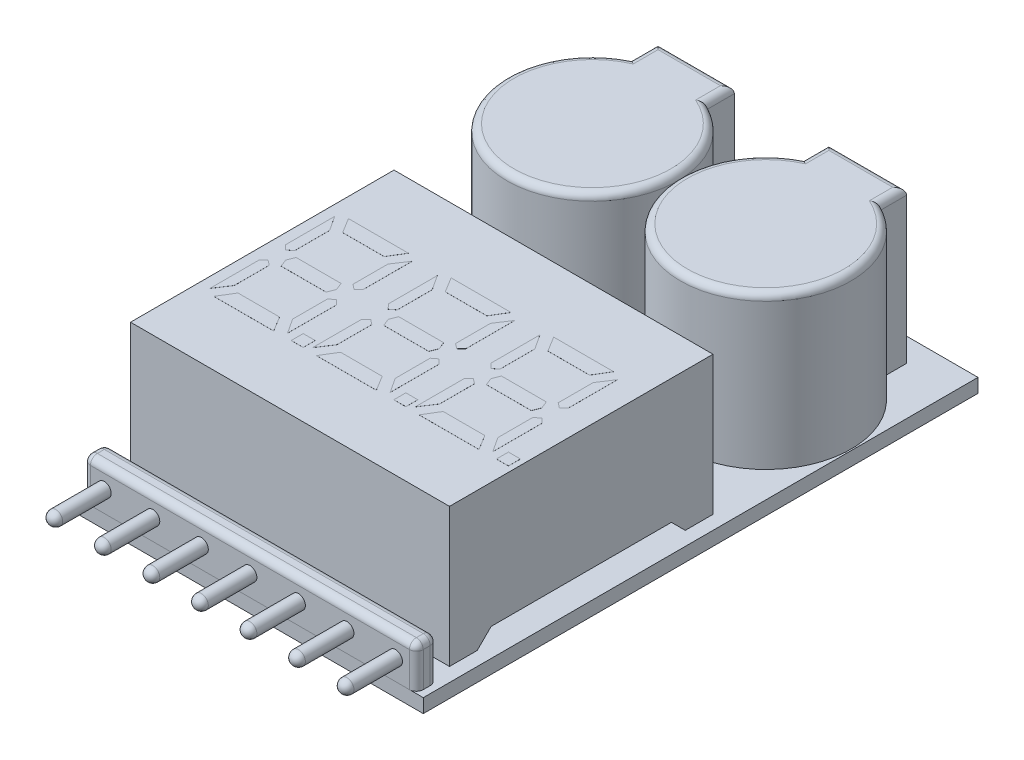
from build123d import *

# Parameters (mm, degrees)
IZIM1_W                         = 25
IZIM1_H                         = 40
Y_KSEKLIK_EKSTR_ZYON1_DEPTH     = 1
IZIM2_W                         = 24
IZIM2_H                         = 1.5
Y_KSEKLIK_EKSTR_ZYON2_DEPTH     = 3
IZIM3_R                         = 0.5
Y_KSEKLIK_EKSTR_ZYON3_DEPTH     = 4
IZIM4_W                         = 23
IZIM4_H                         = 19
Y_KSEKLIK_EKSTR_ZYON4_DEPTH     = 10
Y_KSEKLIK_EKSTR_ZYON10_DEPTH    = 11
KES_EKSTR_ZYON2_DEPTH           = 40
KES_EKSTR_ZYON3_DEPTH           = 20
RADYUS1_R                       = 0.5
RADYUS2_R                       = 0.5
Y_KSEKLIK_EKSTR_ZYON11_DEPTH    = 0.005
Y_KSEKLIK_EKSTR_ZYON11_2_DEPTH  = 0.005
Y_KSEKLIK_EKSTR_ZYON11_3_DEPTH  = 0.005
IZIM8_W                         = 0.864
IZIM8_H                         = 0.864
Y_KSEKLIK_EKSTR_ZYON11_4_DEPTH  = 0.005
Y_KSEKLIK_EKSTR_ZYON11_5_DEPTH  = 0.005
Y_KSEKLIK_EKSTR_ZYON11_6_DEPTH  = 0.005
Y_KSEKLIK_EKSTR_ZYON11_7_DEPTH  = 0.005
Y_KSEKLIK_EKSTR_ZYON11_8_DEPTH  = 0.005
Y_KSEKLIK_EKSTR_ZYON11_9_DEPTH  = 0.005
Y_KSEKLIK_EKSTR_ZYON11_10_DEPTH = 0.005
Y_KSEKLIK_EKSTR_ZYON11_11_DEPTH = 0.005
Y_KSEKLIK_EKSTR_ZYON11_12_DEPTH = 0.005
Y_KSEKLIK_EKSTR_ZYON11_13_DEPTH = 0.005
Y_KSEKLIK_EKSTR_ZYON11_14_DEPTH = 0.005
Y_KSEKLIK_EKSTR_ZYON11_15_DEPTH = 0.005
Y_KSEKLIK_EKSTR_ZYON11_16_DEPTH = 0.005
Y_KSEKLIK_EKSTR_ZYON11_17_DEPTH = 0.005
Y_KSEKLIK_EKSTR_ZYON11_18_DEPTH = 0.005
Y_KSEKLIK_EKSTR_ZYON11_19_DEPTH = 0.005
Y_KSEKLIK_EKSTR_ZYON11_20_DEPTH = 0.005
Y_KSEKLIK_EKSTR_ZYON11_21_DEPTH = 0.005
Y_KSEKLIK_EKSTR_ZYON11_22_DEPTH = 0.005
Y_KSEKLIK_EKSTR_ZYON11_23_DEPTH = 0.005
Y_KSEKLIK_EKSTR_ZYON11_24_DEPTH = 0.005
RADYUS3_R                       = 0.5


with BuildPart() as part:
    # Çizim1 → Yükseklik-Ekstrüzyon1 (new body)
    with BuildSketch(Plane(origin=(0, 0, 0), x_dir=(1, 0, 0), z_dir=(0, 1, 0))):
        Rectangle(IZIM1_W, IZIM1_H)
    extrude(amount=Y_KSEKLIK_EKSTR_ZYON1_DEPTH)

    # Çizim4 → Yükseklik-Ekstrüzyon4 (add)
    with BuildSketch(Plane(origin=(0, 1, 0), x_dir=(1, 0, 0), z_dir=(0, 1, 0))):
        with Locations((0, -7.609299333)):
            Rectangle(IZIM4_W, IZIM4_H)
    extrude(amount=Y_KSEKLIK_EKSTR_ZYON4_DEPTH)

    # Çizim5 → Yükseklik-Ekstrüzyon10 (add)
    with BuildSketch(Plane(origin=(0, 1, 0), x_dir=(1, 0, 0), z_dir=(0, 1, 0))):
        with BuildLine():
            Line((3.448250256, 16.427727605), (3.448250256, 18.297718207))
            Line((3.448250256, 18.297718207), (9.051749744, 18.297718207))
            Line((9.051749744, 18.297718207), (9.051749744, 16.427727605))
            ThreePointArc((9.051749744, 16.427727605), (6.25, 4.788544167), (3.448250256, 16.427727605))
        make_face()
        with BuildLine():
            Line((-9, 16.453867572), (-9, 18.427827016))
            Line((-9, 18.427827016), (-3.5, 18.427827016))
            Line((-3.5, 18.427827016), (-3.5, 16.453867572))
            ThreePointArc((-3.5, 16.453867572), (-6.25, 4.788544167), (-9, 16.453867572))
        make_face()
    extrude(amount=Y_KSEKLIK_EKSTR_ZYON10_DEPTH)

    # Çizim6 → Kes-Ekstrüzyon2 (cut)
    with BuildSketch(Plane.ZY.offset(11.5)):
        Polygon((15.109299333, 1), (14.109299333, 2), (1.109299333, 2), (0.109299333, 1), align=None)
    extrude(amount=-KES_EKSTR_ZYON2_DEPTH, mode=Mode.SUBTRACT)

    # Çizim7 → Kes-Ekstrüzyon3 (cut)
    with BuildSketch(Plane.XY.offset(17.109299333)):
        Polygon((-9.5, 1), (-8.385993234, 2), (8.385993234, 2), (9.283653849, 1), align=None)
    extrude(amount=-KES_EKSTR_ZYON3_DEPTH, mode=Mode.SUBTRACT)

    # Radyus2
    radyus2_edges = [part.edges().sort_by_distance(p)[0] for p in [
        (3.448250256, 12, -17.362722906),
        (6.25, 12, -18.297718207),
        (9.051749744, 12, -17.362722906),
        (6.25, 12, -4.788544167),
        (-9, 12, -17.440847294),
        (-6.25, 12, -18.427827016),
        (-3.5, 12, -17.440847294),
        (-6.25, 12, -4.788544167),
    ]]
    fillet(radyus2_edges, radius=RADYUS2_R)


with BuildPart() as body_2:
    # Çizim2 → Yükseklik-Ekstrüzyon2 (new body)
    with BuildSketch(Plane(origin=(0, 1, 0), x_dir=(1, 0, 0), z_dir=(0, 1, 0))):
        with Locations((0, -19.25)):
            Rectangle(IZIM2_W, IZIM2_H)
    extrude(amount=Y_KSEKLIK_EKSTR_ZYON2_DEPTH)

    # Çizim3 → Yükseklik-Ekstrüzyon3 (add)
    with BuildSketch(Plane.XY.offset(20)):
        with Locations((0, 2.5)):
            Circle(IZIM3_R)
        with Locations((3.5, 2.5)):
            Circle(IZIM3_R)
        with Locations((7, 2.5)):
            Circle(IZIM3_R)
        with Locations((10.5, 2.5)):
            Circle(IZIM3_R)
        with Locations((-3.5, 2.5)):
            Circle(IZIM3_R)
        with Locations((-7, 2.5)):
            Circle(IZIM3_R)
        with Locations((-10.5, 2.5)):
            Circle(IZIM3_R)
    extrude(amount=Y_KSEKLIK_EKSTR_ZYON3_DEPTH)

    # Radyus1
    radyus1_edges = [body_2.edges().sort_by_distance(p)[0] for p in [
        (12, 4, 19.25),
        (0, 4, 20),
        (12, 2.5, 20),
        (-12, 4, 19.25),
        (-12, 2.5, 20),
        (-12, 2.5, 18.5),
        (0, 4, 18.5),
        (12, 2.5, 18.5),
    ]]
    fillet(radyus1_edges, radius=RADYUS1_R)

    # Radyus3
    radyus3_edges = [body_2.edges().sort_by_distance(p)[0] for p in [
        (6.5, 2.5, 24),
        (3, 2.5, 24),
        (-0.5, 2.5, 24),
        (-4, 2.5, 24),
        (-7.5, 2.5, 24),
        (-11, 2.5, 24),
        (10, 2.5, 24),
    ]]
    fillet(radyus3_edges, radius=RADYUS3_R)


with BuildPart() as body_3:
    # Çizim8 → Yükseklik-Ekstrüzyon11 (new body)
    with BuildSketch(Plane(origin=(0, 11, 0), x_dir=(1, 0, 0), z_dir=(0, 1, 0))):
        Polygon((-9.565923628, -7.102635228), (-6.325923628, -7.102635228), (-6.111966697, -7.642635228), (-6.325923628, -8.182635228), (-9.565923628, -8.182635228), (-9.77988056, -7.642635228), align=None)
    extrude(amount=Y_KSEKLIK_EKSTR_ZYON11_DEPTH)


with BuildPart() as body_4:
    # Çizim8 → Y_kseklik-Ekstr_zyon11 2 (new body)
    with BuildSketch(Plane(origin=(0, 11, 0), x_dir=(1, 0, 0), z_dir=(0, 1, 0))):
        Polygon((-6.446228557, -11.4174762), (-9.445618699, -11.4174762), (-10.105923628, -12.4974762), (-5.785923628, -12.4974762), align=None)
    extrude(amount=Y_KSEKLIK_EKSTR_ZYON11_2_DEPTH)


with BuildPart() as body_5:
    # Çizim8 → Y_kseklik-Ekstr_zyon11 3 (new body)
    with BuildSketch(Plane(origin=(0, 11, 0), x_dir=(1, 0, 0), z_dir=(0, 1, 0))):
        Polygon((-10.04799547, -11.079556724), (-10.742963358, -12.137584244), (-10.742963358, -8.607452765), (-10.417746487, -8.274597516), (-10.04799547, -8.558654673), align=None)
    extrude(amount=Y_KSEKLIK_EKSTR_ZYON11_3_DEPTH)


with BuildPart() as body_6:
    # Çizim8 → Y_kseklik-Ekstr_zyon11 4 (new body)
    with BuildSketch(Plane(origin=(0, 11, 0), x_dir=(1, 0, 0), z_dir=(0, 1, 0))):
        with Locations((-4.127020396, -12.031325599)):
            Rectangle(IZIM8_W, IZIM8_H)
    extrude(amount=Y_KSEKLIK_EKSTR_ZYON11_4_DEPTH)


with BuildPart() as body_7:
    # Çizim8 → Y_kseklik-Ekstr_zyon11 5 (new body)
    with BuildSketch(Plane(origin=(0, 11, 0), x_dir=(1, 0, 0), z_dir=(0, 1, 0))):
        Polygon((-5.47410077, -8.274597516), (-5.843851787, -8.558654673), (-5.843851787, -11.079556724), (-5.148883899, -12.137584244), (-5.148883899, -8.607452765), align=None)
    extrude(amount=Y_KSEKLIK_EKSTR_ZYON11_5_DEPTH)


with BuildPart() as body_8:
    # Çizim8 → Y_kseklik-Ekstr_zyon11 6 (new body)
    with BuildSketch(Plane(origin=(0, 11, 0), x_dir=(1, 0, 0), z_dir=(0, 1, 0))):
        Polygon((-2.705923628, -12.4974762), (1.614076372, -12.4974762), (0.953771443, -11.4174762), (-2.045618699, -11.4174762), align=None)
    extrude(amount=Y_KSEKLIK_EKSTR_ZYON11_6_DEPTH)


with BuildPart() as body_9:
    # Çizim8 → Y_kseklik-Ekstr_zyon11 7 (new body)
    with BuildSketch(Plane(origin=(0, 11, 0), x_dir=(1, 0, 0), z_dir=(0, 1, 0))):
        Polygon((-5.785923628, -2.787794256), (-10.105923628, -2.787794256), (-9.445618699, -3.867794256), (-6.446228557, -3.867794256), align=None)
    extrude(amount=Y_KSEKLIK_EKSTR_ZYON11_7_DEPTH)


with BuildPart() as body_10:
    # Çizim8 → Y_kseklik-Ekstr_zyon11 8 (new body)
    with BuildSketch(Plane(origin=(0, 11, 0), x_dir=(1, 0, 0), z_dir=(0, 1, 0))):
        Polygon((4.694076372, -12.4974762), (9.014076372, -12.4974762), (8.353771443, -11.4174762), (5.354381301, -11.4174762), align=None)
    extrude(amount=Y_KSEKLIK_EKSTR_ZYON11_8_DEPTH)


with BuildPart() as body_11:
    # Çizim8 → Y_kseklik-Ekstr_zyon11 9 (new body)
    with BuildSketch(Plane(origin=(0, 11, 0), x_dir=(1, 0, 0), z_dir=(0, 1, 0))):
        Polygon((-5.843851787, -4.205713732), (-5.148883899, -3.147686212), (-5.148883899, -6.677817691), (-5.47410077, -7.01067294), (-5.843851787, -6.726615783), align=None)
    extrude(amount=Y_KSEKLIK_EKSTR_ZYON11_9_DEPTH)


with BuildPart() as body_12:
    # Çizim8 → Y_kseklik-Ekstr_zyon11 10 (new body)
    with BuildSketch(Plane(origin=(0, 11, 0), x_dir=(1, 0, 0), z_dir=(0, 1, 0))):
        Polygon((5.234076372, -8.182635228), (8.474076372, -8.182635228), (8.688033303, -7.642635228), (8.474076372, -7.102635228), (5.234076372, -7.102635228), (5.02011944, -7.642635228), align=None)
    extrude(amount=Y_KSEKLIK_EKSTR_ZYON11_10_DEPTH)


with BuildPart() as body_13:
    # Çizim8 → Y_kseklik-Ekstr_zyon11 11 (new body)
    with BuildSketch(Plane(origin=(0, 11, 0), x_dir=(1, 0, 0), z_dir=(0, 1, 0))):
        Polygon((-10.417746487, -7.01067294), (-10.04799547, -6.726615783), (-10.04799547, -4.205713732), (-10.742963358, -3.147686212), (-10.742963358, -6.677817691), align=None)
    extrude(amount=Y_KSEKLIK_EKSTR_ZYON11_11_DEPTH)


with BuildPart() as body_14:
    # Çizim8 → Y_kseklik-Ekstr_zyon11 12 (new body)
    with BuildSketch(Plane(origin=(0, 11, 0), x_dir=(1, 0, 0), z_dir=(0, 1, 0))):
        Polygon((-2.64799547, -11.079556724), (-3.342963358, -12.137584244), (-3.342963358, -8.607452765), (-3.017746487, -8.274597516), (-2.64799547, -8.558654673), align=None)
    extrude(amount=Y_KSEKLIK_EKSTR_ZYON11_12_DEPTH)


with BuildPart() as body_15:
    # Çizim8 → Y_kseklik-Ekstr_zyon11 13 (new body)
    with BuildSketch(Plane(origin=(0, 11, 0), x_dir=(1, 0, 0), z_dir=(0, 1, 0))):
        Polygon((1.074076372, -8.182635228), (-2.165923628, -8.182635228), (-2.37988056, -7.642635228), (-2.165923628, -7.102635228), (1.074076372, -7.102635228), (1.288033303, -7.642635228), align=None)
    extrude(amount=Y_KSEKLIK_EKSTR_ZYON11_13_DEPTH)


with BuildPart() as body_16:
    # Çizim8 → Y_kseklik-Ekstr_zyon11 14 (new body)
    with BuildSketch(Plane(origin=(0, 11, 0), x_dir=(1, 0, 0), z_dir=(0, 1, 0))):
        with Locations((3.272979604, -12.031325599)):
            Rectangle(IZIM8_W, IZIM8_H)
    extrude(amount=Y_KSEKLIK_EKSTR_ZYON11_14_DEPTH)


with BuildPart() as body_17:
    # Çizim8 → Y_kseklik-Ekstr_zyon11 15 (new body)
    with BuildSketch(Plane(origin=(0, 11, 0), x_dir=(1, 0, 0), z_dir=(0, 1, 0))):
        Polygon((1.92589923, -8.274597516), (1.556148213, -8.558654673), (1.556148213, -11.079556724), (2.251116101, -12.137584244), (2.251116101, -8.607452765), align=None)
    extrude(amount=Y_KSEKLIK_EKSTR_ZYON11_15_DEPTH)


with BuildPart() as body_18:
    # Çizim8 → Y_kseklik-Ekstr_zyon11 16 (new body)
    with BuildSketch(Plane(origin=(0, 11, 0), x_dir=(1, 0, 0), z_dir=(0, 1, 0))):
        Polygon((1.614076372, -2.787794256), (-2.705923628, -2.787794256), (-2.045618699, -3.867794256), (0.953771443, -3.867794256), align=None)
    extrude(amount=Y_KSEKLIK_EKSTR_ZYON11_16_DEPTH)


with BuildPart() as body_19:
    # Çizim8 → Y_kseklik-Ekstr_zyon11 17 (new body)
    with BuildSketch(Plane(origin=(0, 11, 0), x_dir=(1, 0, 0), z_dir=(0, 1, 0))):
        Polygon((1.556148213, -4.205713732), (2.251116101, -3.147686212), (2.251116101, -6.677817691), (1.92589923, -7.01067294), (1.556148213, -6.726615783), align=None)
    extrude(amount=Y_KSEKLIK_EKSTR_ZYON11_17_DEPTH)


with BuildPart() as body_20:
    # Çizim8 → Y_kseklik-Ekstr_zyon11 18 (new body)
    with BuildSketch(Plane(origin=(0, 11, 0), x_dir=(1, 0, 0), z_dir=(0, 1, 0))):
        Polygon((-3.017746487, -7.01067294), (-2.64799547, -6.726615783), (-2.64799547, -4.205713732), (-3.342963358, -3.147686212), (-3.342963358, -6.677817691), align=None)
    extrude(amount=Y_KSEKLIK_EKSTR_ZYON11_18_DEPTH)


with BuildPart() as body_21:
    # Çizim8 → Y_kseklik-Ekstr_zyon11 19 (new body)
    with BuildSketch(Plane(origin=(0, 11, 0), x_dir=(1, 0, 0), z_dir=(0, 1, 0))):
        Polygon((4.75200453, -11.079556724), (4.057036642, -12.137584244), (4.057036642, -8.607452765), (4.382253513, -8.274597516), (4.75200453, -8.558654673), align=None)
    extrude(amount=Y_KSEKLIK_EKSTR_ZYON11_19_DEPTH)


with BuildPart() as body_22:
    # Çizim8 → Y_kseklik-Ekstr_zyon11 20 (new body)
    with BuildSketch(Plane(origin=(0, 11, 0), x_dir=(1, 0, 0), z_dir=(0, 1, 0))):
        with Locations((10.672979604, -12.031325599)):
            Rectangle(IZIM8_W, IZIM8_H)
    extrude(amount=Y_KSEKLIK_EKSTR_ZYON11_20_DEPTH)


with BuildPart() as body_23:
    # Çizim8 → Y_kseklik-Ekstr_zyon11 21 (new body)
    with BuildSketch(Plane(origin=(0, 11, 0), x_dir=(1, 0, 0), z_dir=(0, 1, 0))):
        Polygon((9.32589923, -8.274597516), (8.956148213, -8.558654673), (8.956148213, -11.079556724), (9.651116101, -12.137584244), (9.651116101, -8.607452765), align=None)
    extrude(amount=Y_KSEKLIK_EKSTR_ZYON11_21_DEPTH)


with BuildPart() as body_24:
    # Çizim8 → Y_kseklik-Ekstr_zyon11 22 (new body)
    with BuildSketch(Plane(origin=(0, 11, 0), x_dir=(1, 0, 0), z_dir=(0, 1, 0))):
        Polygon((9.014076372, -2.787794256), (4.694076372, -2.787794256), (5.354381301, -3.867794256), (8.353771443, -3.867794256), align=None)
    extrude(amount=Y_KSEKLIK_EKSTR_ZYON11_22_DEPTH)


with BuildPart() as body_25:
    # Çizim8 → Y_kseklik-Ekstr_zyon11 23 (new body)
    with BuildSketch(Plane(origin=(0, 11, 0), x_dir=(1, 0, 0), z_dir=(0, 1, 0))):
        Polygon((8.956148213, -4.205713732), (9.651116101, -3.147686212), (9.651116101, -6.677817691), (9.32589923, -7.01067294), (8.956148213, -6.726615783), align=None)
    extrude(amount=Y_KSEKLIK_EKSTR_ZYON11_23_DEPTH)


with BuildPart() as body_26:
    # Çizim8 → Y_kseklik-Ekstr_zyon11 24 (new body)
    with BuildSketch(Plane(origin=(0, 11, 0), x_dir=(1, 0, 0), z_dir=(0, 1, 0))):
        Polygon((4.382253513, -7.01067294), (4.75200453, -6.726615783), (4.75200453, -4.205713732), (4.057036642, -3.147686212), (4.057036642, -6.677817691), align=None)
    extrude(amount=Y_KSEKLIK_EKSTR_ZYON11_24_DEPTH)


solid = Compound([part.part, body_2.part, body_3.part, body_4.part, body_5.part, body_6.part, body_7.part, body_8.part, body_9.part, body_10.part, body_11.part, body_12.part, body_13.part, body_14.part, body_15.part, body_16.part, body_17.part, body_18.part, body_19.part, body_20.part, body_21.part, body_22.part, body_23.part, body_24.part, body_25.part, body_26.part])
